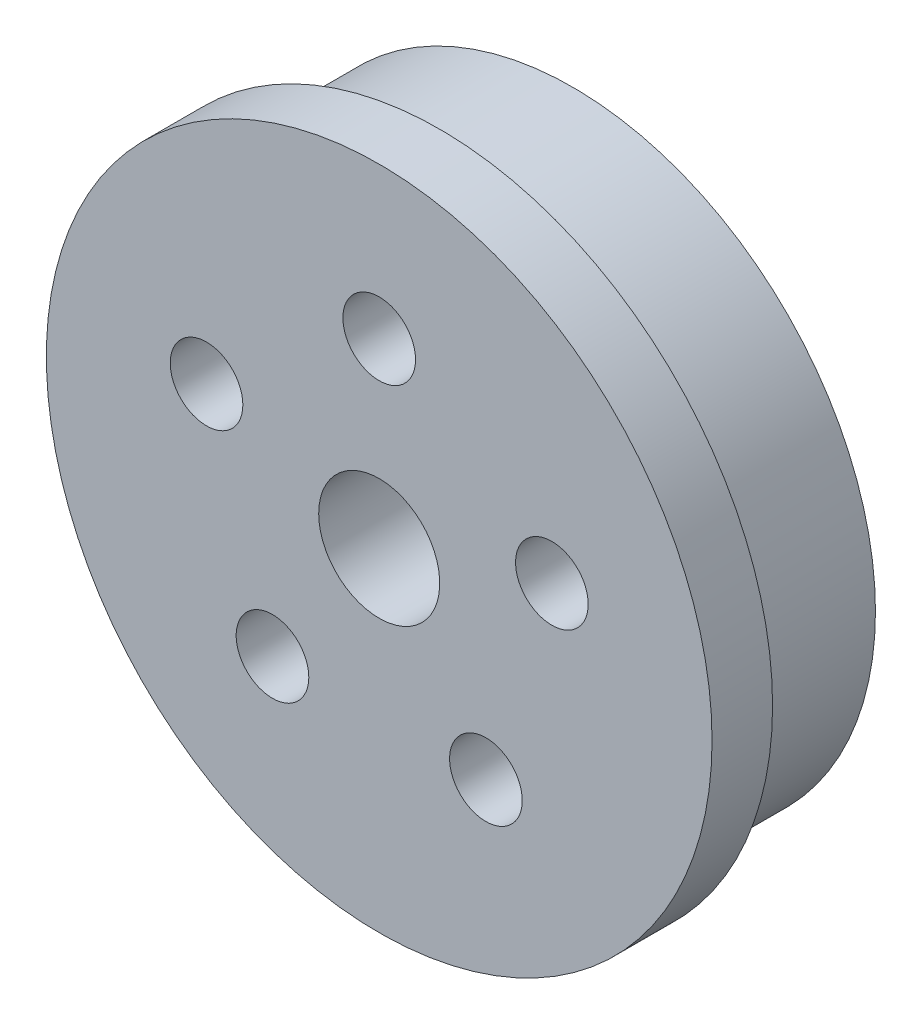
from build123d import *

# Parameters (mm, degrees)
SKETCH_1_R          = 12.5
SKETCH_1_R_2        = 3
EXTRUDE_1_DEPTH     = 8
EXTRUDE_START       = -4.5
SKETCH_2_R          = 3
SKETCH_2_R_2        = 1.5
EXTRUDE_2_DEPTH     = 4.5
EXTRUDE_START_2     = -2.5
SKETCH_3_R          = 13.75
SKETCH_3_R_2        = 12.5
EXTRUDE_3_DEPTH     = 2.5
SKETCH_4_R          = 2.5
CUT_EXTRUDE_1_DEPTH = 22.026768653


with BuildPart() as part:
    # ｽｹｯﾁ1 → ﾎﾞｽ - 押し出し1 (new body)
    with BuildSketch(Plane.XY):
        Circle(SKETCH_1_R)
        with Locations((0, 7.5)):
            Circle(SKETCH_1_R_2, mode=Mode.SUBTRACT)
        with Locations((7.132923872, 2.317627458)):
            Circle(SKETCH_1_R_2, mode=Mode.SUBTRACT)
        with Locations((4.408389392, -6.067627458)):
            Circle(SKETCH_1_R_2, mode=Mode.SUBTRACT)
        with Locations((-4.408389392, -6.067627458)):
            Circle(SKETCH_1_R_2, mode=Mode.SUBTRACT)
        with Locations((-7.132923872, 2.317627458)):
            Circle(SKETCH_1_R_2, mode=Mode.SUBTRACT)
    extrude(amount=EXTRUDE_1_DEPTH)

    # ｽｹｯﾁ2 → ﾎﾞｽ - 押し出し2 (add)
    # profile 1 of 5: a face of its own
    with BuildSketch(Plane.XY.offset(8).offset(EXTRUDE_START)):
        with Locations((-7.132923872, 2.317627458)):
            Circle(SKETCH_2_R)
        with Locations((-7.132923872, 2.317627458)):
            Circle(SKETCH_2_R_2, mode=Mode.SUBTRACT)
    # profile 2 of 5: a face of its own
    with BuildSketch(Plane.XY.offset(8).offset(EXTRUDE_START)):
        with Locations((0, 7.5)):
            Circle(SKETCH_2_R)
        with Locations((0, 7.5)):
            Circle(SKETCH_2_R_2, mode=Mode.SUBTRACT)
    # profile 3 of 5: a face of its own
    with BuildSketch(Plane.XY.offset(8).offset(EXTRUDE_START)):
        with Locations((7.132923872, 2.317627458)):
            Circle(SKETCH_2_R)
        with Locations((7.132923872, 2.317627458)):
            Circle(SKETCH_2_R_2, mode=Mode.SUBTRACT)
    # profile 4 of 5: a face of its own
    with BuildSketch(Plane.XY.offset(8).offset(EXTRUDE_START)):
        with Locations((4.408389392, -6.067627458)):
            Circle(SKETCH_2_R)
        with Locations((4.408389392, -6.067627458)):
            Circle(SKETCH_2_R_2, mode=Mode.SUBTRACT)
    # profile 5 of 5: a face of its own
    with BuildSketch(Plane.XY.offset(8).offset(EXTRUDE_START)):
        with Locations((-4.408389392, -6.067627458)):
            Circle(SKETCH_2_R)
        with Locations((-4.408389392, -6.067627458)):
            Circle(SKETCH_2_R_2, mode=Mode.SUBTRACT)
    extrude(amount=EXTRUDE_2_DEPTH)

    # ｽｹｯﾁ3 → ﾎﾞｽ - 押し出し3 (add)
    with BuildSketch(Plane.XY.offset(8).offset(EXTRUDE_START_2)):
        Circle(SKETCH_3_R)
        Circle(SKETCH_3_R_2, mode=Mode.SUBTRACT)
    extrude(amount=EXTRUDE_3_DEPTH)

    # ｽｹｯﾁ4 → ｶｯﾄ - 押し出し1 (cut, through all)
    with BuildSketch(Plane(origin=(0, 0, 0), x_dir=(-1, 0, 0), z_dir=(0, 0, -1))):
        Circle(SKETCH_4_R)
    extrude(amount=-CUT_EXTRUDE_1_DEPTH, mode=Mode.SUBTRACT)


solid = part.part
